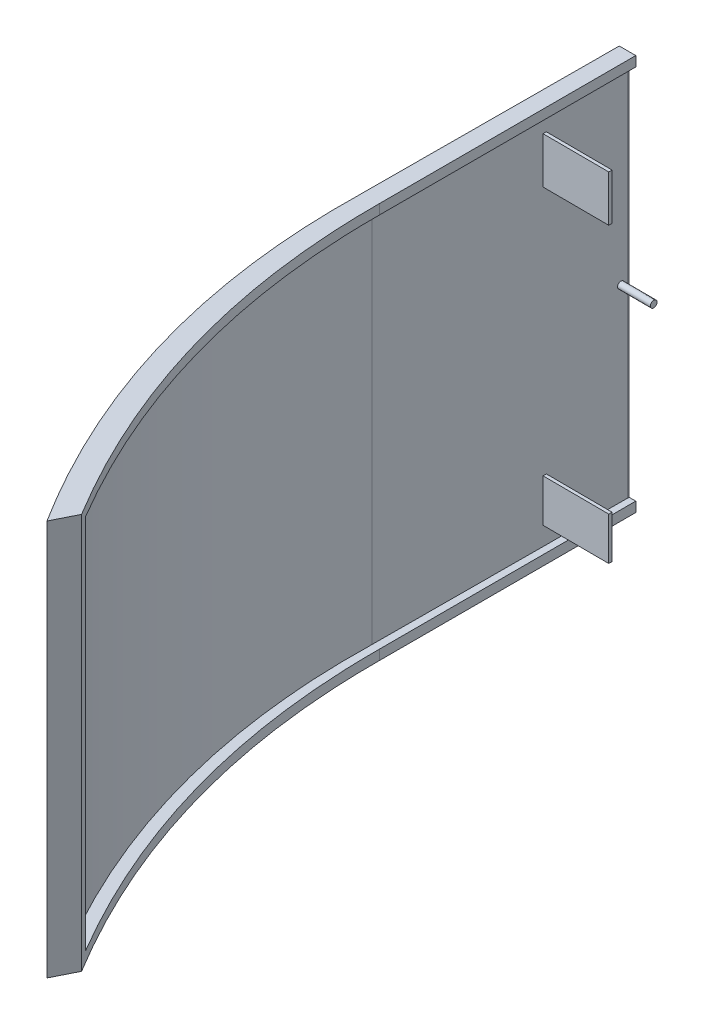
from build123d import *

# Parameters (mm, degrees)
BOSS_EXTRUDE1_DEPTH = 120
SHELL4_START        = 3
SHELL4_DEPTH        = 114
SKETCH12_W          = 3.498967662
SKETCH12_H          = 114
CUT_EXTRUDE5_DEPTH  = 2
SKETCH9_R           = 1.004458273
BOSS_EXTRUDE5_DEPTH = 10
CUT_EXTRUDE6_DEPTH  = 10
SKETCH14_W          = 1
SKETCH14_H          = 12.98385937
SKETCH14_H_2        = 14.006550136
BOSS_EXTRUDE6_DEPTH = 20


# Read off the part's stored shape, not the designer's step: Shell4
with BuildPart() as part:
    # Sketch1 → Boss-Extrude1 (new body)
    with BuildSketch(Plane(origin=(0, 0, 0), x_dir=(1, 0, 0), z_dir=(0, 1, 0))):
        with BuildLine():
            Line((-74.162924852, 98.042139327), (-73.832168128, 178.220414973))
            Line((-73.832168128, 178.220414973), (-68.833436902, 178.220414973))
            Line((-68.833436902, 178.220414973), (-68.833436902, 98.042139327))
            add(Edge.make_bspline(
                [(-68.833436902, 98.042139327), (-69.18939253, 31.860054141), (-32.378727908, -28.786275828)],
                knots=[0, 0, 0, 1, 1, 1], degree=2))
            Line((-32.378727908, -28.786275828), (-35.878727908, -35.78423441))
            add(Edge.make_bspline(
                [(-74.162924852, 98.042139327), (-75.763847477, 27.752135338), (-35.878727908, -35.78423441)],
                knots=[0, 0, 0, 1, 1, 1], degree=2))
        make_face()
    extrude(amount=BOSS_EXTRUDE1_DEPTH)

    # Shell4 outline → Shell4 (cut)
    with BuildSketch(Plane(origin=(0, 0, 0), x_dir=(1, 0, 0), z_dir=(0, 1, 0)).offset(SHELL4_START)):
        with BuildLine():
            Line((-70.8445184, 175.220414973), (-71.163065765, 98.001792885))
            add(Edge.make_bspline(
                [(-71.163065765, 98.001792885), (-71.16307999, 98.001168327), (-71.163094215, 98.000543769), (-71.16310844, 97.999919211), (-71.163122665, 97.999294653), (-71.16313689, 97.998670095), (-71.163151114, 97.998045537), (-71.163165339, 97.997420979), (-71.163179564, 97.996796421), (-71.163193789, 97.996171862), (-71.163208014, 97.995547304), (-71.163222239, 97.994922746), (-71.163236464, 97.994298188), (-71.163250689, 97.99367363), (-71.163293111, 97.991811054), (-71.163321308, 97.990573036), (-71.163349505, 97.989335018), (-71.163377702, 97.988097001), (-71.163405899, 97.986858982), (-71.163434097, 97.985620965), (-71.163462293, 97.984382945), (-71.163490491, 97.98314493), (-71.163518687, 97.98190691), (-71.163546885, 97.980668893), (-71.163575081, 97.979430874), (-71.163603278, 97.978192857), (-71.163631475, 97.976954838), (-71.163673771, 97.975097811), (-71.16368819, 97.974464701), (-71.163699727, 97.973958392), (-71.163723187, 97.972927066), (-71.163717996, 97.973159219), (-71.163755945, 97.971484687), (-71.163749131, 97.971794066), (-71.163775505, 97.970626161), (-71.163784451, 97.97023953), (-71.163799423, 97.969578445), (-71.163813375, 97.968966514), (-71.163827192, 97.968358956), (-71.163841117, 97.967746949), (-71.163868925, 97.96652446), (-71.163882828, 97.965913216), (-71.163896729, 97.965301972), (-71.163910628, 97.964690728), (-71.163924525, 97.964079485), (-71.163938422, 97.963468242), (-71.163952315, 97.962856999), (-71.163966208, 97.962245757), (-71.163980098, 97.961634515), (-71.163993987, 97.961023273), (-71.164007875, 97.960412031), (-71.16402176, 97.95980079), (-71.164035644, 97.959189549), (-71.164105055, 97.956133346), (-71.164160555, 97.953688388), (-71.16421603, 97.951243436), (-71.164271474, 97.948798484), (-71.164326897, 97.946353546), (-71.164382282, 97.943908598), (-71.164437654, 97.941463673), (-71.164492984, 97.939018734), (-71.164548299, 97.936573815), (-71.164603577, 97.93412889), (-71.164658834, 97.931683976), (-71.16471406, 97.929239064), (-71.16476926, 97.926794157), (-71.164934778, 97.919459451), (-71.165045014, 97.914569665), (-71.165155139, 97.909679898), (-71.165265157, 97.904790149), (-71.165375062, 97.899900419), (-71.165484862, 97.895010708), (-71.165594548, 97.890121015), (-71.165704128, 97.885231341), (-71.165813596, 97.880341685), (-71.165922956, 97.875452049), (-71.166032206, 97.87056243), (-71.166141347, 97.86567283), (-71.166250378, 97.860783249), (-71.166577142, 97.846114561), (-71.166794547, 97.83633551), (-71.167011514, 97.826556534), (-71.167228044, 97.816777632), (-71.167444133, 97.806998804), (-71.167659788, 97.797220051), (-71.167875001, 97.787441372), (-71.16808978, 97.777662768), (-71.168304117, 97.767884237), (-71.168518019, 97.758105782), (-71.168731482, 97.7483274), (-71.168944507, 97.738549093), (-71.169157093, 97.72877086), (-71.170217838, 97.679880069), (-71.171059425, 97.640768626), (-71.171894004, 97.601658372), (-71.172721576, 97.56254931), (-71.173542137, 97.523441433), (-71.174355694, 97.484334754), (-71.175162237, 97.445229255), (-71.175961779, 97.406124956), (-71.176754307, 97.367021836), (-71.177539831, 97.327919914), (-71.178318344, 97.288819177), (-71.179089851, 97.249719631), (-71.179854349, 97.210621274), (-71.183641802, 97.015135438), (-71.186559636, 96.858765798), (-71.189365345, 96.702415187), (-71.192058927, 96.546083598), (-71.194640389, 96.389771034), (-71.197109723, 96.233477481), (-71.199466944, 96.077202952), (-71.201712036, 95.920947426), (-71.203845018, 95.764710916), (-71.205865876, 95.608493406), (-71.207774621, 95.452294903), (-71.20957125, 95.296115396), (-71.211255765, 95.139954887), (-71.215972974, 94.671530339), (-71.21866933, 94.359323281), (-71.220917246, 94.047192171), (-71.222716731, 93.735136985), (-71.224067792, 93.423157694), (-71.224970441, 93.111254278), (-71.225424682, 92.799426705), (-71.22543053, 92.487674957), (-71.224987988, 92.175999001), (-71.224097069, 91.864398817), (-71.222757779, 91.552874376), (-71.220970129, 91.241425656), (-71.218734126, 90.930052628), (-71.210681088, 89.996160551), (-71.203519041, 89.373868515), (-71.194563692, 88.751878946), (-71.183815094, 88.130191631), (-71.171273301, 87.508806354), (-71.156938367, 86.887722903), (-71.140810347, 86.266941062), (-71.122889291, 85.646460617), (-71.103175256, 85.026281355), (-71.081668294, 84.406403059), (-71.058368459, 83.786825518), (-71.033275804, 83.167548515), (-71.006390383, 82.548571838), (-70.920355984, 80.692542137), (-70.855828771, 79.456389412), (-70.784130946, 78.221435319), (-70.70526281, 76.987678074), (-70.619224622, 75.75511588), (-70.52601661, 74.52374694), (-70.425638953, 73.293569436), (-70.318091806, 72.064581558), (-70.20337527, 70.836781468), (-70.081489423, 69.610167339), (-69.952434295, 68.384737319), (-69.816209883, 67.16048956), (-69.672816143, 65.937422197), (-69.221126701, 62.271755688), (-68.891322913, 59.832692682), (-68.532840831, 57.398329004), (-68.145679077, 54.968649529), (-67.729835685, 52.543639338), (-67.285308121, 50.123283736), (-66.812093252, 47.707568223), (-66.310187385, 45.296478532), (-65.779586225, 42.890000586), (-65.220284915, 40.488120539), (-64.632278003, 38.090824743), (-64.015559465, 35.698099773), (-63.370122691, 33.309932408), (-61.444530757, 26.501652756), (-60.094120868, 22.092657129), (-58.644686559, 17.699242409), (-57.096177659, 13.321333259), (-55.448539032, 8.958860031), (-53.701711499, 4.611759301), (-51.855632693, 0.279974273), (-49.910237914, -4.036544954), (-47.865460912, -8.33784126), (-45.721234657, -12.6239505), (-43.477492061, -16.894901644), (-41.134166666, -21.150717052), (-38.691193295, -25.391412877), (-36.148508666, -29.616999611)],
                knots=[-0.000198917, -0.000198917, -0.000198917, -0.000198917, -0.000198917, -0.000198917, -0.000198917, -0.000198917, -0.000198917, -0.000198917, -0.000198917, -0.000198917, -0.000198917, -0.000198917, -0.000198917, -0.000136719, -0.000136719, -0.000136719, -0.000136719, -0.000136719, -0.000136719, -0.000136719, -0.000136719, -0.000136719, -0.000136719, -0.000136719, -0.000136719, -0.000136719, -1.3428e-05, -1.3428e-05, -1.3428e-05, -1.3428e-05, -1.3428e-05, -1.3428e-05, -1.3428e-05, -1.3428e-05, -1.3428e-05, -1.3428e-05, -1.3428e-05, -1.3428e-05, -1.3428e-05, 4.8218e-05, 4.8218e-05, 4.8218e-05, 4.8218e-05, 4.8218e-05, 4.8218e-05, 4.8218e-05, 4.8218e-05, 4.8218e-05, 4.8218e-05, 4.8218e-05, 4.8218e-05, 4.8218e-05, 0.000109863, 0.000109863, 0.000109863, 0.000109863, 0.000109863, 0.000109863, 0.000109863, 0.000109863, 0.000109863, 0.000109863, 0.000109863, 0.000109863, 0.000109863, 0.000356445, 0.000356445, 0.000356445, 0.000356445, 0.000356445, 0.000356445, 0.000356445, 0.000356445, 0.000356445, 0.000356445, 0.000356445, 0.000356445, 0.000356445, 0.000849609, 0.000849609, 0.000849609, 0.000849609, 0.000849609, 0.000849609, 0.000849609, 0.000849609, 0.000849609, 0.000849609, 0.000849609, 0.000849609, 0.000849609, 0.001835937, 0.001835937, 0.001835937, 0.001835937, 0.001835937, 0.001835937, 0.001835937, 0.001835937, 0.001835937, 0.001835937, 0.001835937, 0.001835937, 0.001835937, 0.00578125, 0.00578125, 0.00578125, 0.00578125, 0.00578125, 0.00578125, 0.00578125, 0.00578125, 0.00578125, 0.00578125, 0.00578125, 0.00578125, 0.00578125, 0.0215625, 0.0215625, 0.0215625, 0.0215625, 0.0215625, 0.0215625, 0.0215625, 0.0215625, 0.0215625, 0.0215625, 0.0215625, 0.0215625, 0.0215625, 0.053125, 0.053125, 0.053125, 0.053125, 0.053125, 0.053125, 0.053125, 0.053125, 0.053125, 0.053125, 0.053125, 0.053125, 0.053125, 0.11625, 0.11625, 0.11625, 0.11625, 0.11625, 0.11625, 0.11625, 0.11625, 0.11625, 0.11625, 0.11625, 0.11625, 0.11625, 0.2425, 0.2425, 0.2425, 0.2425, 0.2425, 0.2425, 0.2425, 0.2425, 0.2425, 0.2425, 0.2425, 0.2425, 0.2425, 0.495, 0.495, 0.495, 0.495, 0.495, 0.495, 0.495, 0.495, 0.495, 0.495, 0.495, 0.495, 0.495, 0.963709177, 0.963709177, 0.963709177, 0.963709177, 0.963709177, 0.963709177, 0.963709177, 0.963709177, 0.963709177, 0.963709177, 0.963709177, 0.963709177, 0.963709177, 0.963709177, 0.963709177], degree=14))
            Line((-36.148508666, -29.616999611), (-34.206134458, -25.733384151))
            add(Edge.make_bspline(
                [(-34.206134458, -25.733384151), (-69.180443526, 33.523923752), (-68.833436902, 98.042139327)],
                knots=[0.025140786, 0.025140786, 0.025140786, 1, 1, 1], degree=2))
            Line((-68.833436902, 98.042139327), (-68.833436902, 175.220414973))
            Line((-68.833436902, 175.220414973), (-70.8445184, 175.220414973))
        make_face()
    extrude(amount=SHELL4_DEPTH, mode=Mode.SUBTRACT)

    # Sketch12 → Cut-Extrude5 (cut)
    with BuildSketch(Plane(origin=(-68.833436902, 0, 0), x_dir=(0, 0, -1), z_dir=(1, 0, 0))):
        with Locations((176.969898804, 60)):
            Rectangle(SKETCH12_W, SKETCH12_H)
    extrude(amount=-CUT_EXTRUDE5_DEPTH, mode=Mode.SUBTRACT)

    # Sketch9 → Boss-Extrude5 (add)
    with BuildSketch(Plane(origin=(-71.566131341, 0, -0.295229336), x_dir=(0.004125231010775818, 0, -0.9999914911983541), z_dir=(0.999991491198354, 0, 0.004125231010775817))):
        with Locations((172.925450661, 60)):
            Circle(SKETCH9_R)
    extrude(amount=BOSS_EXTRUDE5_DEPTH)

    # Sketch13 → Cut-Extrude6 (cut)
    with BuildSketch(Plane(origin=(-68.833436902, 0, 0), x_dir=(0, 0, -1), z_dir=(1, 0, 0))):
        Polygon((178.220414973, 120), (175.719029806, 120), (175.719029806, 0), (178.721352067, 0), (178.721352067, 120), align=None)
    extrude(amount=-CUT_EXTRUDE6_DEPTH, mode=Mode.SUBTRACT)

    # Sketch14 → Boss-Extrude6 (add)
    with BuildSketch(Plane(origin=(-71.566131341, 0, -0.295229336), x_dir=(0.004125231010775816, 0, -0.9999914911983541), z_dir=(0.999991491198354, 0, 0.004125231010775815))):
        with Locations((149.920607502, 15.084769689)):
            Rectangle(SKETCH14_W, SKETCH14_H)
        with Locations((149.920607502, 104.418723374)):
            Rectangle(SKETCH14_W, SKETCH14_H_2)
    extrude(amount=BOSS_EXTRUDE6_DEPTH)


solid = part.part
